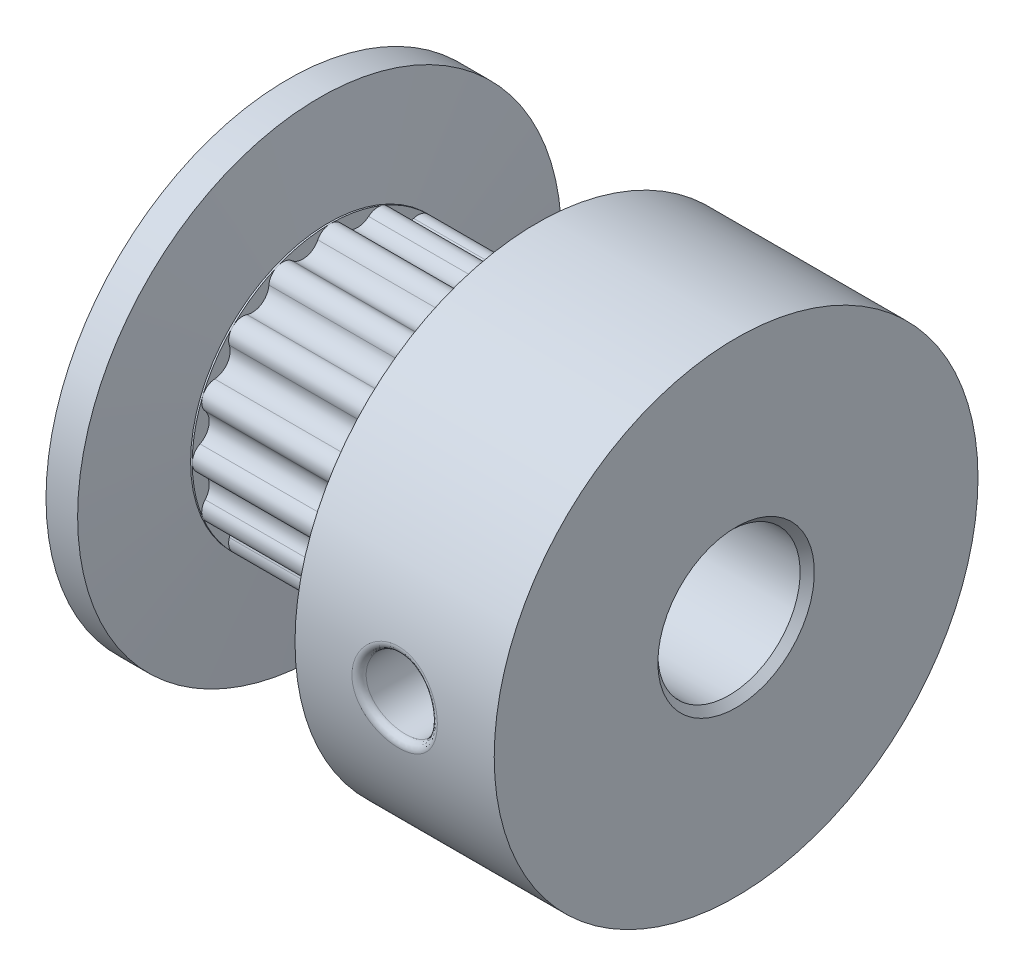
from build123d import *

# Parameters (mm, degrees)
SKETCH1_R          = 1.25
CUT_EXTRUDE1_DEPTH = 581.534882673
CUT_EXTRUDE2_START = -0.25
SKETCH2_R          = 8.5
SKETCH2_R_2        = 3.5
CUT_EXTRUDE2_DEPTH = 0.25
CUT_EXTRUDE3_START = -8.49
SKETCH3_R          = 8.5
CUT_EXTRUDE3_DEPTH = 7
FILLET1_R          = 0.25
CHAMFER1_SIZE      = 0.25


# Read off the part's stored shape, not the designer's step: Stock-axis-master-1
with BuildPart() as part:
    # Stock-axis-master-1 outline → Stock-axis-master-1 (revolve)
    with BuildSketch(Plane(origin=(0, 534, 0), x_dir=(0, 1, 0), z_dir=(0, 0, -1))):
        Polygon((8.5, 190.5), (8.5, 191.861332756), (4.85, 192.180666378), (4.85, 199.180666378), (8.5, 199.5), (8.5, 206.5), (2.5, 206.5), (2.5, 190.5), align=None)
    revolve(axis=Axis((0, 534, 0), (1, 0, 0)))

    # Sketch1 → Cut-Extrude1 (cut, through all)
    with BuildSketch(Plane.XY):
        with Locations(Location((203, 534, 0), (0, 0, 180))):
            Circle(SKETCH1_R)
    extrude(amount=CUT_EXTRUDE1_DEPTH, mode=Mode.SUBTRACT)

    # Sketch2 → Cut-Extrude2 (cut)
    with BuildSketch(Plane.ZY.offset(-190.5).offset(CUT_EXTRUDE2_START)):
        with Locations((0, 534)):
            Circle(SKETCH2_R)
        with Locations((0, 534)):
            Circle(SKETCH2_R_2, mode=Mode.SUBTRACT)
    extrude(amount=CUT_EXTRUDE2_DEPTH, mode=Mode.SUBTRACT)

    # Sketch3 → Cut-Extrude3 (cut)
    with BuildSketch(Plane.ZY.offset(-190.75).offset(CUT_EXTRUDE3_START)):
        with Locations((0, 534)):
            Circle(SKETCH3_R)
        with BuildLine():
            ThreePointArc((-0.438684101, 538.579034424), (0, 538.85), (0.438684101, 538.579034424))
            ThreePointArc((0.438684101, 538.579034424), (0.848642901, 538.26641597), (1.347029348, 538.398353321))
            ThreePointArc((1.347029348, 538.398353321), (1.856014647, 538.480815733), (2.157611873, 538.062599046))
            ThreePointArc((2.157611873, 538.062599046), (2.416730514, 537.616892814), (2.92766979, 537.548062795))
            ThreePointArc((2.92766979, 537.548062795), (3.429467889, 537.429467889), (3.548062795, 536.92766979))
            ThreePointArc((3.548062795, 536.92766979), (3.616892814, 536.416730514), (4.062599046, 536.157611873))
            ThreePointArc((4.062599046, 536.157611873), (4.480815733, 535.856014647), (4.398353321, 535.347029348))
            ThreePointArc((4.398353321, 535.347029348), (4.26641597, 534.848642901), (4.579034424, 534.438684101))
            ThreePointArc((4.579034424, 534.438684101), (4.85, 534), (4.579034424, 533.561315899))
            ThreePointArc((4.579034424, 533.561315899), (4.26641597, 533.151357099), (4.398353321, 532.652970652))
            ThreePointArc((4.398353321, 532.652970652), (4.480815733, 532.143985353), (4.062599046, 531.842388127))
            ThreePointArc((4.062599046, 531.842388127), (3.616892814, 531.583269486), (3.548062795, 531.07233021))
            ThreePointArc((3.548062795, 531.07233021), (3.429467889, 530.570532111), (2.92766979, 530.451937205))
            ThreePointArc((2.92766979, 530.451937205), (2.416730514, 530.383107186), (2.157611873, 529.937400954))
            ThreePointArc((2.157611873, 529.937400954), (1.856014647, 529.519184267), (1.347029348, 529.601646679))
            ThreePointArc((1.347029348, 529.601646679), (0.848642901, 529.73358403), (0.438684101, 529.420965576))
            ThreePointArc((0.438684101, 529.420965576), (0, 529.15), (-0.438684101, 529.420965576))
            ThreePointArc((-0.438684101, 529.420965576), (-0.848642901, 529.73358403), (-1.347029348, 529.601646679))
            ThreePointArc((-1.347029348, 529.601646679), (-1.856014647, 529.519184267), (-2.157611873, 529.937400954))
            ThreePointArc((-2.157611873, 529.937400954), (-2.416730514, 530.383107186), (-2.92766979, 530.451937205))
            ThreePointArc((-2.92766979, 530.451937205), (-3.429467889, 530.570532111), (-3.548062795, 531.07233021))
            ThreePointArc((-3.548062795, 531.07233021), (-3.616892814, 531.583269486), (-4.062599046, 531.842388127))
            ThreePointArc((-4.062599046, 531.842388127), (-4.480815733, 532.143985353), (-4.398353321, 532.652970652))
            ThreePointArc((-4.398353321, 532.652970652), (-4.26641597, 533.151357099), (-4.579034424, 533.561315899))
            ThreePointArc((-4.579034424, 533.561315899), (-4.85, 534), (-4.579034424, 534.438684101))
            ThreePointArc((-4.579034424, 534.438684101), (-4.26641597, 534.848642901), (-4.398353321, 535.347029348))
            ThreePointArc((-4.398353321, 535.347029348), (-4.480815733, 535.856014647), (-4.062599046, 536.157611873))
            ThreePointArc((-4.062599046, 536.157611873), (-3.616892814, 536.416730514), (-3.548062795, 536.92766979))
            ThreePointArc((-3.548062795, 536.92766979), (-3.429467889, 537.429467889), (-2.92766979, 537.548062795))
            ThreePointArc((-2.92766979, 537.548062795), (-2.416730514, 537.616892814), (-2.157611873, 538.062599046))
            ThreePointArc((-2.157611873, 538.062599046), (-1.856014647, 538.480815733), (-1.347029348, 538.398353321))
            ThreePointArc((-1.347029348, 538.398353321), (-0.848642901, 538.26641597), (-0.438684101, 538.579034424))
        make_face(mode=Mode.SUBTRACT)
    extrude(amount=CUT_EXTRUDE3_DEPTH, mode=Mode.SUBTRACT)

    # Fillet1
    fillet1_edges = [part.edges().sort_by_distance(p)[0] for p in [
        (204.250000003, 534, 8.500000028),
    ]]
    fillet(fillet1_edges, radius=FILLET1_R)

    # Chamfer1
    chamfer1_edges = [part.edges().sort_by_distance(p)[0] for p in [
        (206.5, 531.5, 0),
    ]]
    chamfer(chamfer1_edges, length=CHAMFER1_SIZE)


solid = part.part
